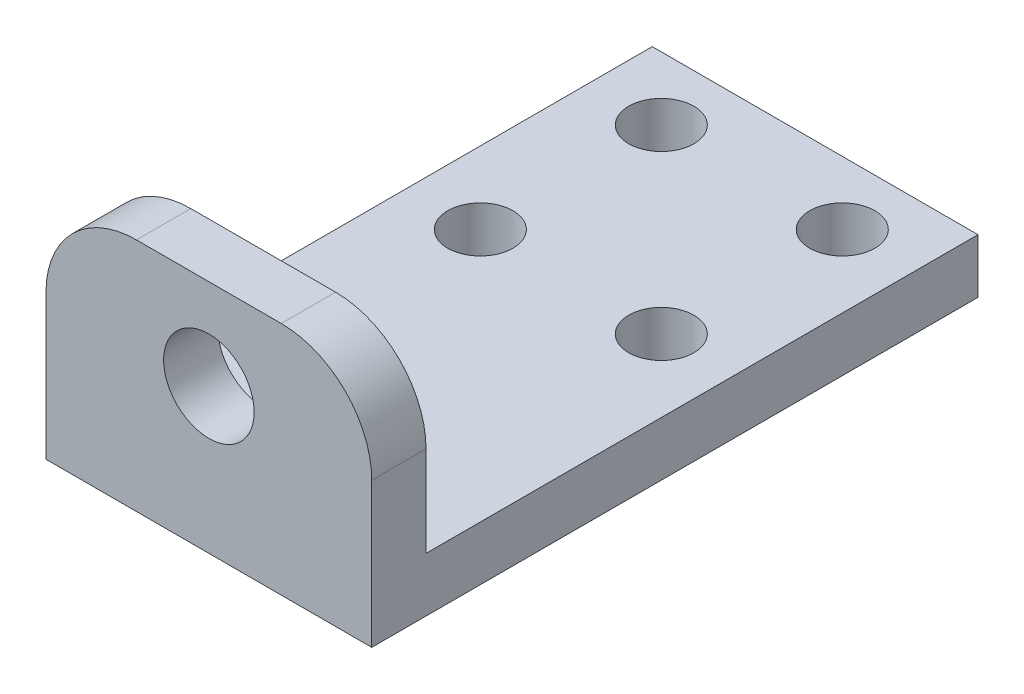
from build123d import *

# Parameters (mm, degrees)
BOSS_EXTRUDE1_DEPTH       = 18
F_5_0MM_DOWEL_HOLE1_D     = 5
F_5_0MM_DOWEL_HOLE1_DEPTH = 3
F_5_0MM_DOWEL_HOLE1_TIP   = 1.502151548
FILLET1_R                 = 5
M3_CLEARANCE_HOLE1_D      = 3.6


with BuildPart() as part:
    # Sketch1 → Boss-Extrude1 (new body)
    with BuildSketch(Plane(origin=(0, 0, 0), x_dir=(0, 0, -1), z_dir=(1, 0, 0))):
        Polygon((0, 0), (33.5, 0), (33.5, 3), (3, 3), (3, 13), (0, 13), align=None)
    extrude(amount=BOSS_EXTRUDE1_DEPTH)

    # Ø5.0mm Dowel Hole1
    with Locations(Plane.XY):
        with Locations((9, 8)):
            Hole(F_5_0MM_DOWEL_HOLE1_D / 2, depth=F_5_0MM_DOWEL_HOLE1_DEPTH)
            with Locations((0, 0, -(F_5_0MM_DOWEL_HOLE1_DEPTH + F_5_0MM_DOWEL_HOLE1_TIP / 2))):  # 118° drill point
                Cone(0, F_5_0MM_DOWEL_HOLE1_D / 2, F_5_0MM_DOWEL_HOLE1_TIP, mode=Mode.SUBTRACT)

    # Fillet1
    fillet1_edges = [part.edges().sort_by_distance(p)[0] for p in [
        (0, 13, -1.5),
        (18, 13, -1.5),
    ]]
    fillet(fillet1_edges, radius=FILLET1_R)

    # M3 Clearance Hole1 (through all)
    with Locations(Plane(origin=(0, 3, 0), x_dir=(1, 0, 0), z_dir=(0, 1, 0))):
        with Locations((14, 30), (4, 30), (4, 20), (14, 20)):
            Hole(M3_CLEARANCE_HOLE1_D / 2)


solid = part.part
